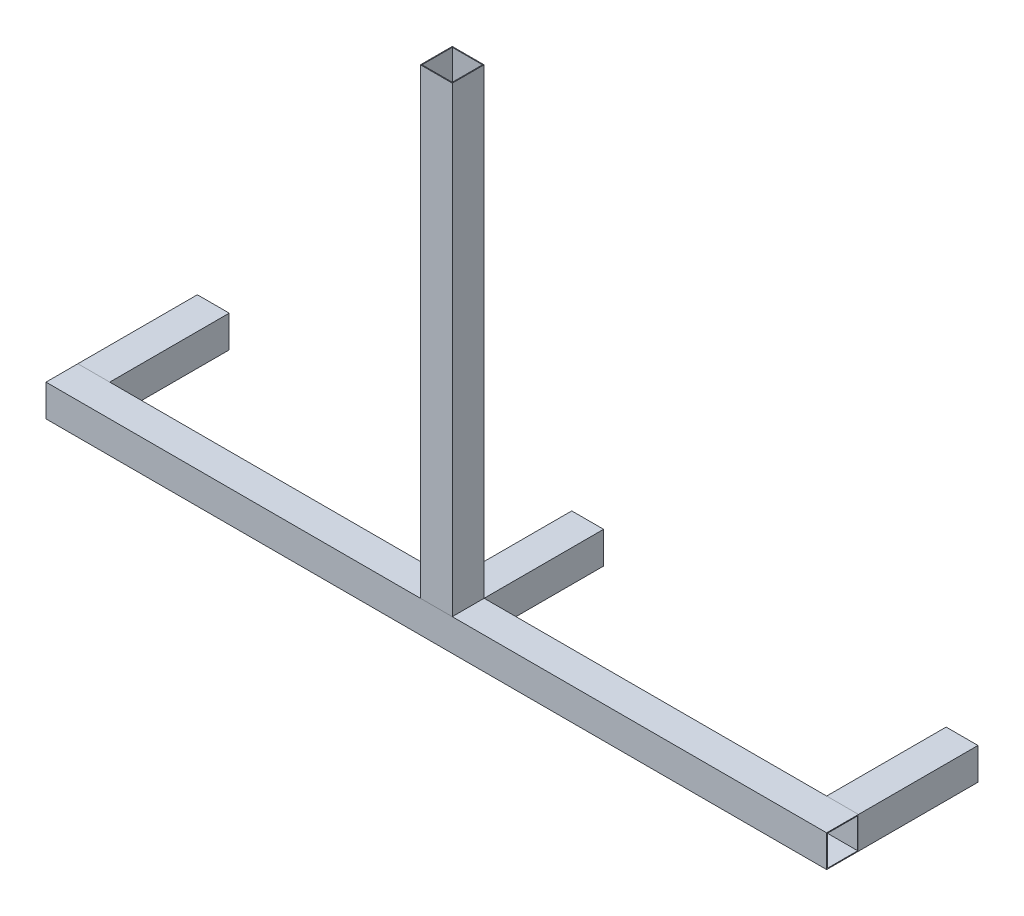
from build123d import *

# Parameters (mm, degrees)
CROQUIS1_W              = 40
CROQUIS1_H              = 40
CROQUIS1_W_2            = 38
CROQUIS1_H_2            = 38
EXTRUIR_L_MINA1_DEPTH   = 490
CROQUIS2_W              = 40
CROQUIS2_H              = 40
CROQUIS2_W_2            = 38
CROQUIS2_H_2            = 38
EXTRUIR_L_MINA3_DEPTH   = 150
CROQUIS3_W              = 40
CROQUIS3_H              = 40
CROQUIS3_W_2            = 38
CROQUIS3_H_2            = 38
EXTRUIR_L_MINA5_DEPTH   = 150
EXTRUIR_L_MINA5_2_DEPTH = 150
CROQUIS4_W              = 40
CROQUIS4_H              = 40
CROQUIS4_W_2            = 38
CROQUIS4_H_2            = 38
EXTRUIR_L_MINA6_DEPTH   = 580


with BuildPart() as part:
    # Croquis1 → Extruir-Lámina1 (new, symmetric)
    with BuildSketch(Plane(origin=(0, 0, 0), x_dir=(0, 0, -1), z_dir=(1, 0, 0))):
        Rectangle(CROQUIS1_W, CROQUIS1_H)
        Rectangle(CROQUIS1_W_2, CROQUIS1_H_2, mode=Mode.SUBTRACT)
    extrude(amount=EXTRUIR_L_MINA1_DEPTH, both=True)


with BuildPart() as body_2:
    # Croquis2 → Extruir-Lámina3 (new body)
    with BuildSketch(Plane(origin=(0, 0, -20), x_dir=(-1, 0, 0), z_dir=(0, 0, -1))):
        Rectangle(CROQUIS2_W, CROQUIS2_H)
        Rectangle(CROQUIS2_W_2, CROQUIS2_H_2, mode=Mode.SUBTRACT)
    extrude(amount=EXTRUIR_L_MINA3_DEPTH)


with BuildPart() as body_3:
    # Croquis3 → Extruir-Lámina5 (new body)
    with BuildSketch(Plane(origin=(0, 0, -20), x_dir=(-1, 0, 0), z_dir=(0, 0, -1))):
        with Locations((-470, 0)):
            Rectangle(CROQUIS3_W, CROQUIS3_H)
        with Locations((-470, 0)):
            Rectangle(CROQUIS3_W_2, CROQUIS3_H_2, mode=Mode.SUBTRACT)
    extrude(amount=EXTRUIR_L_MINA5_DEPTH)


with BuildPart() as body_4:
    # Croquis3 → Extruir-L_mina5 2 (new body)
    with BuildSketch(Plane(origin=(0, 0, -20), x_dir=(-1, 0, 0), z_dir=(0, 0, -1))):
        with Locations((470, 0)):
            Rectangle(CROQUIS3_W, CROQUIS3_H)
        with Locations((470, 0)):
            Rectangle(CROQUIS3_W_2, CROQUIS3_H_2, mode=Mode.SUBTRACT)
    extrude(amount=EXTRUIR_L_MINA5_2_DEPTH)


with BuildPart() as body_5:
    # Croquis4 → Extruir-Lámina6 (new body)
    with BuildSketch(Plane(origin=(0, 20, 0), x_dir=(1, 0, 0), z_dir=(0, 1, 0))):
        Rectangle(CROQUIS4_W, CROQUIS4_H)
        Rectangle(CROQUIS4_W_2, CROQUIS4_H_2, mode=Mode.SUBTRACT)
    extrude(amount=EXTRUIR_L_MINA6_DEPTH)


solid = Compound([part.part, body_2.part, body_3.part, body_4.part, body_5.part])
